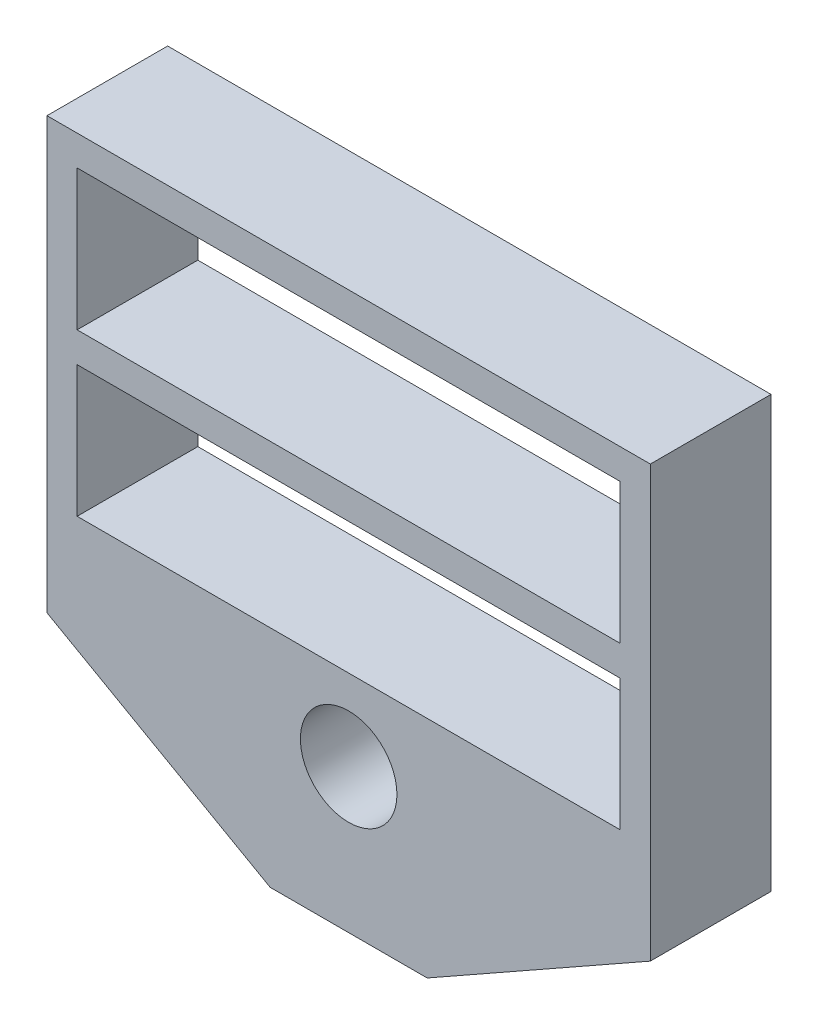
from build123d import *

# Parameters (mm, degrees)
BOSS_EXTRUDE2_DEPTH      = 10
BOSS_EXTRUDE2_DEPTH_BACK = 10
EXTRUDE_THIN2_START      = -10
EXTRUDE_THIN2_DEPTH      = 20
SKETCH2_W                = 20
SKETCH2_H                = 2.5
BOSS_EXTRUDE3_DEPTH      = 90


# Read off the part's stored shape, not the designer's step: Extrude-Thin2
with BuildPart() as part:
    # Sketch1 → Boss-Extrude2 (new, two sides: drawn at the far end of the back side and taken through both)
    with BuildSketch(Plane.XY.offset(-BOSS_EXTRUDE2_DEPTH_BACK)):
        Polygon((-13.01396445, -23.830717844), (0, -23.830717844), (0, -18.830717844), (-11.698214449, -18.830717844), (-45, 0), (-45, 13.432214294), (-50, 13.432214294), (-50, -2.916716145), align=None)
        Polygon((0, -18.830717844), (0, -23.830717844), (13.01396445, -23.830717844), (50, -2.916716145), (50, 13.432214294), (45, 13.432214294), (45, 0), (11.698214449, -18.830717844), align=None)
        with BuildLine():
            Line((-11.698214449, -18.830717844), (0, -18.830717844))
            Line((0, -18.830717844), (0, -8))
            ThreePointArc((0, -8), (-8, 0), (0, 8))
            Line((0, 8), (0, 13.432214294))
            Line((0, 13.432214294), (-45, 13.432214294))
            Line((-45, 13.432214294), (-45, 0))
            Line((-45, 0), (-11.698214449, -18.830717844))
        make_face()
        with BuildLine():
            Line((0, -8), (0, -18.830717844))
            Line((0, -18.830717844), (11.698214449, -18.830717844))
            Line((11.698214449, -18.830717844), (45, 0))
            Line((45, 0), (45, 13.432214294))
            Line((45, 13.432214294), (0, 13.432214294))
            Line((0, 13.432214294), (0, 8))
            ThreePointArc((0, 8), (5.656854249, 5.656854249), (8, 0))
            ThreePointArc((8, 0), (5.656854249, -5.656854249), (0, -8))
        make_face()
    extrude(amount=BOSS_EXTRUDE2_DEPTH + BOSS_EXTRUDE2_DEPTH_BACK)

    # Extrude-Thin2 outline → Extrude-Thin2 (add)
    with BuildSketch(Plane.XY.offset(EXTRUDE_THIN2_START)):
        Polygon((45, 13.432214294), (50, 13.432214294), (50, 68.432214294), (-50, 68.432214294), (-50, 13.432214294), (-45, 13.432214294), (-45, 63.432214294), (45, 63.432214294), align=None)
    extrude(amount=EXTRUDE_THIN2_DEPTH)

    # Sketch2 → Boss-Extrude3 (add)
    with BuildSketch(Plane.ZY.offset(-45)):
        with Locations((0, 38.944873029)):
            Rectangle(SKETCH2_W, SKETCH2_H)
        with Locations((0, 36.444873029)):
            Rectangle(SKETCH2_W, SKETCH2_H)
    extrude(amount=BOSS_EXTRUDE3_DEPTH)


solid = part.part
